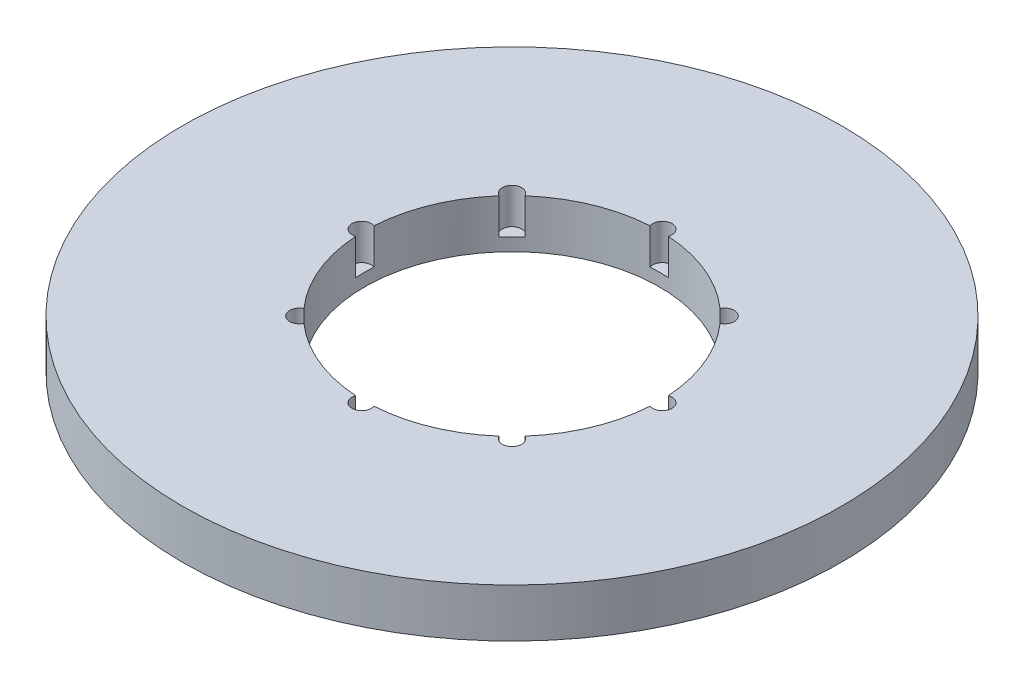
from build123d import *

# Parameters (mm, degrees)
SKETCH1_R           = 95
BOSS_EXTRUDE1_DEPTH = 14
SKETCH2_R           = 42.5
CUT_EXTRUDE1_DEPTH  = 136.077755386
SKETCH3_R           = 2.78412642
CUT_EXTRUDE2_DEPTH  = 10.324557631
CIRPATTERN1_COUNT   = 8


with BuildPart() as part:
    # Sketch1 → Boss-Extrude1 (new body)
    with BuildSketch(Plane(origin=(0, 0, 0), x_dir=(1, 0, 0), z_dir=(0, 1, 0))):
        Circle(SKETCH1_R)
    extrude(amount=BOSS_EXTRUDE1_DEPTH)

    # Sketch2 → Cut-Extrude1 (cut, through all)
    with BuildSketch(Plane(origin=(0, 0, 0), x_dir=(1, 0, 0), z_dir=(0, 1, 0))):
        Circle(SKETCH2_R)
    extrude(amount=CUT_EXTRUDE1_DEPTH, mode=Mode.SUBTRACT)

    # Sketch3 → Cut-Extrude2 (cut)
    with BuildSketch(Plane(origin=(0, 14, 0), x_dir=(1, 0, 0), z_dir=(0, 1, 0))):
        with Locations((-43.3472045, 0)):
            Circle(SKETCH3_R)
    cut_extrude2 = extrude(amount=-CUT_EXTRUDE2_DEPTH, mode=Mode.SUBTRACT)

    # CirPattern1: Cut-Extrude2 ×8 about axis
    cirpattern1_axis = Axis((0, 0, 0), (0, 1, 0))
    for i in range(1, CIRPATTERN1_COUNT):
        add(cut_extrude2.rotate(cirpattern1_axis, i * 360 / CIRPATTERN1_COUNT), mode=Mode.SUBTRACT)


solid = part.part
